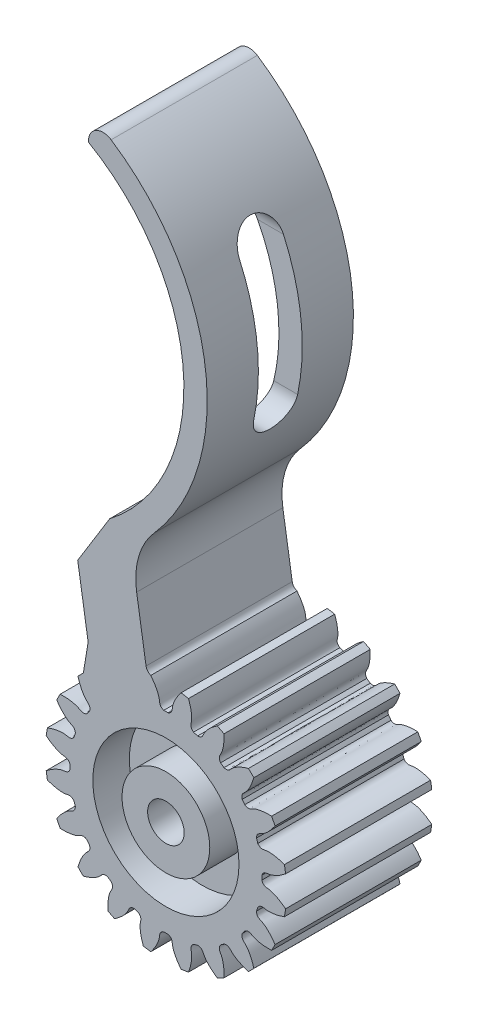
from build123d import *

# Parameters (mm, degrees)
SKETCH_1_R               = 16.5
EXTRUDE_1_DEPTH          = 20
CUT_EXTRUDE_1_DEPTH      = 31.732718721
PATTERN_CIRCULAR_1_COUNT = 20
EXTRUDE_START            = -20
EXTRUDE_2_DEPTH          = 20
FILLET_1_R               = 1
FILLET_2_R               = 2
FILLET_4_R               = 10
SKETCH_5_R               = 2.5
CUT_EXTRUDE_2_DEPTH      = 20
SKETCH_7_R               = 10
CUT_EXTRUDE_3_DEPTH      = 3
CUT_EXTRUDE_START        = -5
SKETCH_8_R               = 10
SKETCH_8_R_2             = 6
CUT_EXTRUDE_4_DEPTH      = 5
CUT_EXTRUDE_5_DEPTH      = 10
CUT_EXTRUDE_5_DEPTH_BACK = 10


with BuildPart() as part:
    # 草图1 → 凸台-拉伸1 (new body)
    with BuildSketch(Plane.XY):
        Circle(SKETCH_1_R)
    extrude(amount=EXTRUDE_1_DEPTH)

    # 草图2 → 切除-拉伸1 (cut, through all)
    with BuildSketch(Plane.XY):
        with BuildLine():
            ThreePointArc((0.289974901, 13.121796354), (0, 13.125), (-0.289974901, 13.121796354))
            add(Edge.make_bspline(
                [(-0.289974901, 13.121796354), (-0.916784107, 13.340213268), (-0.835626149, 13.780670548), (-0.919345585, 14.205014104), (-0.928338279, 14.246334921), (-0.939466335, 14.292951923), (-0.952938145, 14.344795254), (-0.96896871, 14.401787245), (-0.987768083, 14.463844242), (-1.009544807, 14.5308761), (-1.034504625, 14.602786421), (-1.06285065, 14.679472568), (-1.094783098, 14.760825751), (-1.130499153, 14.846731096), (-1.170192797, 14.937067727), (-1.214054647, 15.031708847), (-1.2622718, 15.130521826), (-1.315027675, 15.233368292), (-1.372501858, 15.340104225), (-1.434869948, 15.450580056), (-1.502303414, 15.564640771), (-1.574969439, 15.682126017), (-1.653030782, 15.802870208), (-1.736645634, 15.926702646), (-1.825967477, 16.05344763), (-1.921144951, 16.182924586), (-2.022321721, 16.314948181), (-2.129636342, 16.449328459), (-2.24322214, 16.585870967), (-2.363207078, 16.724376892), (-2.489713645, 16.864643194), (-2.622858733, 17.006462752), (-2.762753527, 17.149624504), (-2.909503389, 17.29391359), (-3.06320776, 17.439111509), (-3.223960048, 17.584996263), (-3.391847534, 17.731342516), (-3.566951278, 17.877921749), (-3.749346018, 18.024502419), (-3.939100102, 18.170850122), (-4.136275349, 18.31672776), (-4.412210386, 18.512459802), (-4.625898619, 18.654498902), (-4.771736973, 18.747377789)],
                knots=[0, 0, 0, 0, 0.165916003, 0.170905922, 0.176663519, 0.183188797, 0.190481754, 0.198542391, 0.207370708, 0.216966704, 0.22733038, 0.238461736, 0.250360771, 0.263027487, 0.276461881, 0.290663956, 0.30563371, 0.321371144, 0.337876258, 0.355149051, 0.373189524, 0.391997677, 0.411573509, 0.431917021, 0.453028213, 0.474907084, 0.497553636, 0.520967867, 0.545149777, 0.570099367, 0.595816637, 0.622301587, 0.649554216, 0.677574526, 0.706362514, 0.735918183, 0.766241531, 0.797332559, 0.829191267, 0.861817654, 0.895211721, 0.929373468, 1, 1, 1, 1], degree=3))
            ThreePointArc((-4.771736973, 18.747377789), (0, 19.345119481), (4.771736973, 18.747377789))
            add(Edge.make_bspline(
                [(0.289974901, 13.121796354), (0.916784107, 13.340213268), (0.835626149, 13.780670548), (0.919345585, 14.205014104), (0.928338279, 14.246334921), (0.939466335, 14.292951923), (0.952938145, 14.344795254), (0.96896871, 14.401787245), (0.987768083, 14.463844242), (1.009544807, 14.5308761), (1.034504625, 14.602786421), (1.06285065, 14.679472568), (1.094783098, 14.760825751), (1.130499153, 14.846731096), (1.170192797, 14.937067727), (1.214054647, 15.031708847), (1.2622718, 15.130521826), (1.315027675, 15.233368292), (1.372501858, 15.340104225), (1.434869948, 15.450580056), (1.502303414, 15.564640771), (1.574969439, 15.682126017), (1.653030782, 15.802870208), (1.736645634, 15.926702646), (1.825967477, 16.05344763), (1.921144951, 16.182924586), (2.022321721, 16.314948181), (2.129636342, 16.449328459), (2.24322214, 16.585870967), (2.363207078, 16.724376892), (2.489713645, 16.864643194), (2.622858733, 17.006462752), (2.762753527, 17.149624504), (2.909503389, 17.29391359), (3.06320776, 17.439111509), (3.223960048, 17.584996263), (3.391847534, 17.731342516), (3.566951278, 17.877921749), (3.749346018, 18.024502419), (3.939100102, 18.170850122), (4.136275349, 18.31672776), (4.412210386, 18.512459802), (4.625898619, 18.654498902), (4.771736973, 18.747377789)],
                knots=[0, 0, 0, 0, 0.165916003, 0.170905922, 0.176663519, 0.183188797, 0.190481754, 0.198542391, 0.207370708, 0.216966704, 0.22733038, 0.238461736, 0.250360771, 0.263027487, 0.276461881, 0.290663956, 0.30563371, 0.321371144, 0.337876258, 0.355149051, 0.373189524, 0.391997677, 0.411573509, 0.431917021, 0.453028213, 0.474907084, 0.497553636, 0.520967867, 0.545149777, 0.570099367, 0.595816637, 0.622301587, 0.649554216, 0.677574526, 0.706362514, 0.735918183, 0.766241531, 0.797332559, 0.829191267, 0.861817654, 0.895211721, 0.929373468, 1, 1, 1, 1], degree=3))
        make_face()
    cut_extrude_1 = extrude(amount=CUT_EXTRUDE_1_DEPTH, mode=Mode.SUBTRACT)

    # 阵列(圆周)1: 切除-拉伸1 ×20 about axis
    pattern_circular_1_axis = Axis((0, 0, -1.5), (0, 0, 1))
    for i in range(1, PATTERN_CIRCULAR_1_COUNT):
        add(cut_extrude_1.rotate(pattern_circular_1_axis, i * 360 / PATTERN_CIRCULAR_1_COUNT), mode=Mode.SUBTRACT)


with BuildPart() as extrude_2_tool:
    # 草图4 → 凸台-拉伸2 (new body)
    with BuildSketch(Plane.XY.offset(20).offset(EXTRUDE_START)):
        with BuildLine():
            ThreePointArc((-10.585309869, 75.270801181), (2.434492626, 51.533585521), (-12.707173491, 29.090310103))
            Line((-12.707173491, 29.090310103), (-10.638462888, 16.028985398))
            Line((-10.638462888, 16.028985398), (-9.921456121, 11.501982843))
            add(Edge.make_bspline(
                [(-9.921456121, 11.501982843), (-9.918703082, 11.500559653), (-9.852537081, 11.466286234), (-9.730890834, 11.400191512), (-9.589612349, 11.315967266), (-9.466858859, 11.237556123), (-9.37982057, 11.17834971), (-9.300755502, 11.120900284), (-9.249070303, 11.081745113), (-9.202602252, 11.045060153), (-9.150343301, 11.002082969), (-9.104978437, 10.962582681), (-8.776110671, 10.657627941), (-8.582874544, 10.253587065), (-7.947393003, 10.445313277)],
                knots=[0.69310037, 0.69310037, 0.69310037, 0.69310037, 0.69436629, 0.723538119, 0.749639229, 0.761538264, 0.783033296, 0.792629292, 0.801457609, 0.809518246, 0.816811203, 0.829094078, 0.834083997, 1, 1, 1, 1], degree=3))
            ThreePointArc((-7.947393003, 10.445313277), (-7.714681436, 10.618348051), (-7.478203758, 10.786199217))
            add(Edge.make_bspline(
                [(-7.478203758, 10.786199217), (-7.099486698, 11.33133142), (-7.424039159, 11.639965394), (-7.612442624, 12.046973423), (-7.635991116, 12.102324233), (-7.660715943, 12.16530613), (-7.681245996, 12.220836149), (-7.71083511, 12.306060717), (-7.748703597, 12.427161912), (-7.792731572, 12.590510669), (-7.835215538, 12.777480211), (-7.874329115, 12.988173006), (-7.908236264, 13.222583157), (-7.935097524, 13.480595599), (-7.953075711, 13.761985925), (-7.960341751, 14.066420428), (-7.956565619, 14.30111124), (-7.951281332, 14.434194698), (-7.950219677, 14.458354231)],
                knots=[0, 0, 0, 0, 0.165916003, 0.170905922, 0.183188797, 0.190481754, 0.198542391, 0.207370708, 0.22733038, 0.250360771, 0.276461881, 0.30563371, 0.337876258, 0.373189524, 0.411573509, 0.453028213, 0.497553636, 0.507431698, 0.507431698, 0.507431698, 0.507431698], degree=3))
            ThreePointArc((-7.950219677, 14.458354231), (-7.490843246, 14.701607649), (-7.024032405, 14.930270218))
            add(Edge.make_bspline(
                [(-7.024032405, 14.930270218), (-6.912948778, 14.856790614), (-6.720224904, 14.722766352), (-6.458979768, 14.52326582), (-6.24189748, 14.343324096), (-6.048949658, 14.169936981), (-5.879237949, 14.004722705), (-5.731774221, 13.849237063), (-5.623437121, 13.725477592), (-5.530921989, 13.612971249), (-5.466439445, 13.529766293), (-5.408996946, 13.450696193), (-5.371941014, 13.397485807), (-5.339083547, 13.34823692), (-5.302663012, 13.291214284), (-5.271724722, 13.239628764), (-5.053189088, 12.847973843), (-4.994266108, 12.403994888), (-4.330640589, 12.389962756)],
                knots=[0.492568302, 0.492568302, 0.492568302, 0.492568302, 0.546971787, 0.588426491, 0.626810476, 0.662123742, 0.69436629, 0.723538119, 0.749639229, 0.761538264, 0.783033296, 0.792629292, 0.801457609, 0.809518246, 0.816811203, 0.829094078, 0.834083997, 1, 1, 1, 1], degree=3))
            ThreePointArc((-4.330640589, 12.389962756), (-4.055848051, 12.482616776), (-3.779075551, 12.5691771))
            add(Edge.make_bspline(
                [(-3.779075551, 12.5691771), (-3.250439109, 12.970598627), (-3.463733699, 13.364419205), (-3.517143644, 13.809726715), (-3.522435249, 13.869645348), (-3.526487481, 13.937185083), (-3.528853002, 13.996341404), (-3.530658082, 14.086538325), (-3.529250826, 14.213414411), (-3.520646377, 14.382373703), (-3.503274264, 14.573320573), (-3.475365832, 14.785788088), (-3.435176726, 15.019203275), (-3.380993074, 15.272888275), (-3.311136952, 15.546061943), (-3.223971932, 15.837841691), (-3.147857168, 16.059879028), (-3.101706462, 16.184815984), (-3.093231062, 16.207464996)],
                knots=[0, 0, 0, 0, 0.165916003, 0.170905922, 0.183188797, 0.190481754, 0.198542391, 0.207370708, 0.22733038, 0.250360771, 0.276461881, 0.30563371, 0.337876258, 0.373189524, 0.411573509, 0.453028213, 0.497553636, 0.507431698, 0.507431698, 0.507431698, 0.507431698], degree=3))
            Line((-3.093231062, 16.207464996), (-2.581168673, 16.29685762))
            Line((-2.581168673, 16.29685762), (-4.805666766, 30.341785823))
            ThreePointArc((-4.805666766, 30.341785823), (5.398938755, 56.554151755), (-11.269260032, 79.21233462))
            Line((-11.269260032, 79.21233462), (-10.585309869, 75.270801181))
        make_face()
        with BuildLine():
            Line((-9.921456121, 11.501982843), (-10.638462888, 16.028985398))
            Line((-10.638462888, 16.028985398), (-11.293959017, 12.028985398))
            add(Edge.make_bspline(
                [(-11.293959017, 12.028985398), (-11.165605763, 11.993428871), (-10.940898693, 11.925519176), (-10.630790749, 11.816512081), (-10.368728174, 11.712459448), (-10.134477341, 11.608440656), (-9.988822046, 11.536807812), (-9.921456121, 11.501982843)],
                knots=[0.492568302, 0.492568302, 0.492568302, 0.492568302, 0.546971787, 0.588426491, 0.626810476, 0.662123742, 0.69310037, 0.69310037, 0.69310037, 0.69310037], degree=3))
        make_face()
    extrude(amount=EXTRUDE_2_DEPTH)


with BuildPart() as part_1:
    add(part.part)


with BuildPart() as part_2:
    # 凸台-拉伸2: joined with extrude_2_tool
    add(part_1.part.fuse(extrude_2_tool.part, tol=0.00001))

    # 圆角1
    # the kernel refuses this fillet: 1 mm, written as the material it adds along each edge
    with BuildSketch(Plane(origin=(-2.581168673, 16.29685762, 0), x_dir=(0.9900299133467207, 0.14085727059220135, 0), z_dir=(0, 0, 1))) as fillet_1_piece_1:
        with BuildLine():
            CenterArc((0.986188646, 0.884583413), FILLET_1_R, 180.902544173, 61.297755274)
            Line((-0.013687288, 0.868831697), (-0.033684807, 0.868516662))
            Line((-0.033684807, 0.868516662), (-0.019997519, -0.000315034))
            Line((-0.019997519, -0.000315034), (0.000315034, -0.019997519))
            ThreePointArc((0.000315034, -0.019997519), (0.259903314, -0.017952911), (0.510478988, -0.017691668))
            Line((0.510478988, -0.017691668), (0.519806629, 0))
        make_face()
    extrude(amount=20)

    # 圆角2
    # the kernel refuses this fillet: 2 mm, written as the material it takes off along each edge
    with BuildSketch(Plane(origin=(-11.269260032, 79.21233462, -10.804324523), x_dir=(0.8737678183188975, -0.4863432940529091, 0), z_dir=(0, 0, 1))) as fillet_2_piece_1:
        with BuildLine():
            CenterArc((4.173669786, -1.994512028), FILLET_2_R, 85.754508866, 128.192038812)
            Line((2.514551999, -3.111350499), (2.481369643, -3.133687268))
            ThreePointArc((2.481369643, -3.133687268), (1.226165871, -1.58081804), (-0.031110128, -0.025142791))
            Line((-0.031110128, -0.025142791), (-0.0029612, 0.039890241))
            ThreePointArc((-0.0029612, 0.039890241), (2.160864905, 0.120094316), (4.32469101, 0.039890241))
            Line((4.32469101, 0.039890241), (4.321729809, 0))
        make_face()
    extrude(amount=41.608649046, mode=Mode.SUBTRACT)

    # 圆角4
    fillet_4_edges = [part_2.edges().sort_by_distance(p)[0] for p in [
        (-4.805666766, 30.341785823, 10),
    ]]
    fillet(fillet_4_edges, radius=FILLET_4_R)

    # 草图5 → 切除-拉伸2 (cut)
    with BuildSketch(Plane.XY.offset(20)):
        Circle(SKETCH_5_R)
    extrude(amount=-CUT_EXTRUDE_2_DEPTH, mode=Mode.SUBTRACT)

    # 倒角1
    # the kernel refuses this chamfer: 7.206221188, 5 mm, written as the material it takes off along each edge
    with BuildSketch(Plane(origin=(-12.707173491, 29.090310103, -15.305906315), x_dir=(0.8563189904159998, 0.5164472738362773, 0), z_dir=(0, 0, 1))) as chamfer_1_piece_1:
        with BuildLine():
            Line((6.120939246, 0.132006216), (-1.806978449, -3.952102234))
            Line((-1.806978449, -3.952102234), (-1.940519302, -3.89789255))
            ThreePointArc((-1.940519302, -3.89789255), (-0.950036223, -1.95715579), (-0.133540854, 0.054209685))
            Line((-0.133540854, 0.054209685), (0.016254723, 0.143204865))
            ThreePointArc((0.016254723, 0.143204865), (3.060904423, -0.021443994), (6.104684523, 0.275211082))
            Line((6.104684523, 0.275211082), (6.120939246, 0.132006216))
        make_face()
    extrude(amount=50.61181263, mode=Mode.SUBTRACT)

    # 草图7 → 切除-拉伸3 (cut)
    with BuildSketch(Plane(origin=(0, 0, 0), x_dir=(-1, 0, 0), z_dir=(0, 0, -1))):
        Circle(SKETCH_7_R)
    extrude(amount=-CUT_EXTRUDE_3_DEPTH, mode=Mode.SUBTRACT)

    # 草图8 → 切除-拉伸4 (cut)
    with BuildSketch(Plane.XY.offset(20).offset(CUT_EXTRUDE_START)):
        with Locations(Location((0, 0, 0), (0, 0, 180))):
            Circle(SKETCH_8_R)
        Circle(SKETCH_8_R_2, mode=Mode.SUBTRACT)
    extrude(amount=CUT_EXTRUDE_4_DEPTH, mode=Mode.SUBTRACT)

    # 草图9 → 切除-拉伸5 (cut, two sides: drawn at the far end of the back side and taken through both)
    with BuildSketch(Plane(origin=(0, 0, 0), x_dir=(0, 0, -1), z_dir=(1, 0, 0)).offset(-CUT_EXTRUDE_5_DEPTH_BACK)):
        with BuildLine():
            Line((-13, 46.7), (-13, 64.7))
            ThreePointArc((-13, 64.7), (-10, 67.7), (-7, 64.7))
            Line((-7, 64.7), (-7, 46.7))
            ThreePointArc((-7, 46.7), (-10, 43.7), (-13, 46.7))
        make_face()
    extrude(amount=CUT_EXTRUDE_5_DEPTH + CUT_EXTRUDE_5_DEPTH_BACK, mode=Mode.SUBTRACT)


solid = part_2.part
